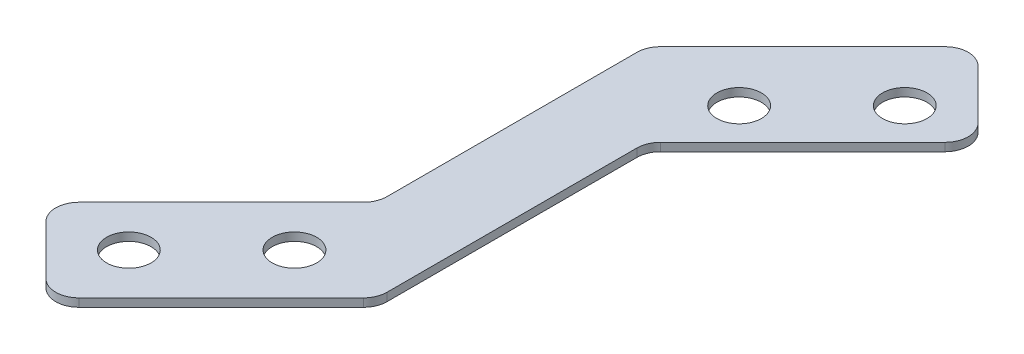
from build123d import *

# Parameters (mm, degrees)
BASE_FLANGE2_DEPTH    = 0.7
F_6_CLEARANCE_HOLE1_D = 3.7973
FILLET1_R             = 2


# Sheet-metal steps are written as plain solids
with BuildPart() as part:
    # Sketch1 → Base-Flange2 (new body)
    with BuildSketch(Plane(origin=(0, 0, 0), x_dir=(1, 0, 0), z_dir=(0, 1, 0))):
        Polygon((0, 0), (0, 23), (14.142135624, 37.142135624), (7.071067812, 44.213203436), (-7.071067812, 30.071067812), (-7.071067812, 7.071067812), (-21.213203436, -7.071067812), (-14.142135624, -14.142135624), align=None)
    extrude(amount=-BASE_FLANGE2_DEPTH)

    # #6 Clearance Hole1 (through all)
    with Locations(Plane(origin=(0, 0, 0), x_dir=(1, 0, 0), z_dir=(0, 1, 0))):
        with Locations((-14.139821541, -7.073381895), (-7.068753729, -0.002314083), (1.237436867, 29.653874811), (8.308504679, 36.724942623)):
            Hole(F_6_CLEARANCE_HOLE1_D / 2)

    # Fillet1
    fillet1_edges = [part.edges().sort_by_distance(p)[0] for p in [
        (-14.142135624, -0.35, 14.142135624),
        (-21.213203436, -0.35, 7.071067812),
        (-7.071067812, -0.35, -7.071067812),
        (-7.071067812, -0.35, -30.071067812),
        (7.071067812, -0.35, -44.213203436),
        (14.142135624, -0.35, -37.142135624),
        (0, -0.35, -23),
        (0, -0.35, 0),
    ]]
    fillet(fillet1_edges, radius=FILLET1_R)


solid = part.part
